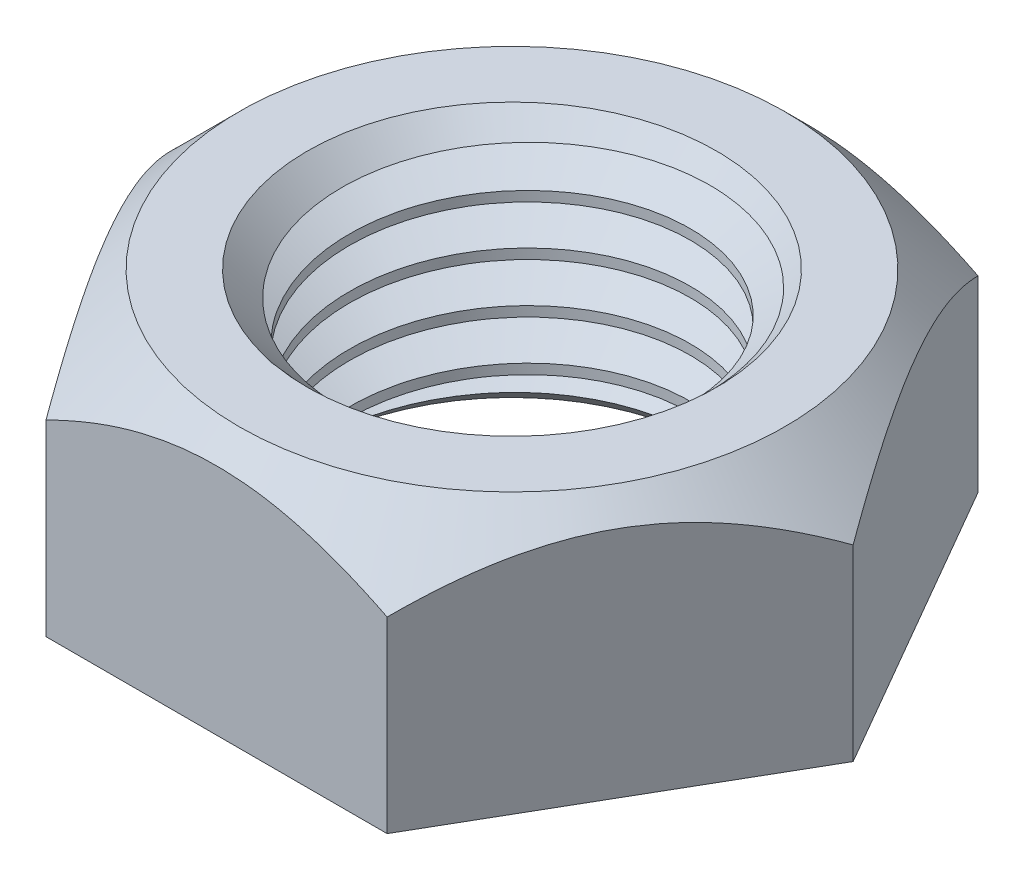
from build123d import *

# Parameters (mm, degrees)
SKETCH1_R           = 12.7
SKETCH1_R_2         = 6.35
BOSS_EXTRUDE1_DEPTH = 9.525
CHAMFER1_SIZE       = 2.54
SKETCH2_OUTSIDE_W   = 34.832
SKETCH2_OUTSIDE_H   = 34.832
CUT_EXTRUDE1_DEPTH  = 21.329919454
CHAMFER2_SIZE       = 1.27
CUT_SWEEP1_PITCH    = 1.856153846


with BuildPart() as part:
    # Sketch1 → Boss-Extrude1 (new body)
    with BuildSketch(Plane(origin=(0, 0, 0), x_dir=(1, 0, 0), z_dir=(0, 1, 0))):
        with Locations(Location((0, 0, 0), (0, 0, 90))):
            Circle(SKETCH1_R)
        with Locations(Location((0, 0, 0), (0, 0, 90))):
            Circle(SKETCH1_R_2, mode=Mode.SUBTRACT)
    extrude(amount=BOSS_EXTRUDE1_DEPTH)

    # Chamfer1
    chamfer1_edges = [part.edges().sort_by_distance(p)[0] for p in [
        (0, 9.525, 12.7),
    ]]
    chamfer(chamfer1_edges, length=CHAMFER1_SIZE)

    # Sketch2 outside → Cut-Extrude1 (cut, through all)
    with BuildSketch(Plane(origin=(0, 9.525, 0), x_dir=(1, 0, 0), z_dir=(0, 1, 0))):
        Rectangle(SKETCH2_OUTSIDE_W, SKETCH2_OUTSIDE_H)
        Polygon((-12.7, 0), (-6.35, -10.998522628), (6.35, -10.998522628), (12.7, 0), (6.35, 10.998522628), (-6.35, 10.998522628), align=None, mode=Mode.SUBTRACT)
    extrude(amount=-CUT_EXTRUDE1_DEPTH, mode=Mode.SUBTRACT)

    # Chamfer2
    chamfer2_edges = [part.edges().sort_by_distance(p)[0] for p in [
        (0, 0, 6.35),
        (0, 9.525, 6.35),
    ]]
    chamfer(chamfer2_edges, length=CHAMFER2_SIZE)

    # Cut-Sweep1: the profile of Sketch6 screwed along a left-hand helix of 6.5 turns, 10 arcs to a turn; built about Z, then put on its axis
    cut_sweep1_z = Axis((0, 0, 0), (0, 0, 1))
    cut_sweep1_corners = [(6.096, 0, 0.146646968), (6.096, 0, -1.631353032), (7.635793168, 0, -0.742353032)]
    with BuildLine(mode=Mode.PRIVATE) as cut_sweep1_profile:
        Line(cut_sweep1_corners[0], cut_sweep1_corners[1])
        Line(cut_sweep1_corners[1], cut_sweep1_corners[2])
        Line(cut_sweep1_corners[2], cut_sweep1_corners[0])
    cut_sweep1_cap = Face(cut_sweep1_profile.wire())
    cut_sweep1_turn_angles = [0, -18, -36, -54, -72, -90, -108, -126, -144, -162, -180, -198, -216, -234, -252, -270, -288, -306, -324, -342, -360]
    cut_sweep1_turn_weights = [1, 0.9510565162951535, 1, 0.9510565162951535, 1, 0.9510565162951535, 1, 0.9510565162951535, 1, 0.9510565162951535, 1, 0.9510565162951535, 1, 0.9510565162951535, 1, 0.9510565162951535, 1, 0.9510565162951535, 1, 0.9510565162951535, 1]
    cut_sweep1_turn_rails = [Edge.make_bspline([Vector(p[0], p[1], 0).rotate(cut_sweep1_z, cut_sweep1_turn_angles[k]) / cut_sweep1_turn_weights[k] + Vector(0, 0, p[2] + -CUT_SWEEP1_PITCH * cut_sweep1_turn_angles[k] / 360) for k in range(21)], [0, 0, 0, 1, 1, 2, 2, 3, 3, 4, 4, 5, 5, 6, 6, 7, 7, 8, 8, 9, 9, 10, 10, 10], 2, cut_sweep1_turn_weights) for p in cut_sweep1_corners]
    cut_sweep1_turn_sides = [Face.make_surface_from_curves(cut_sweep1_turn_rails[p[0]], cut_sweep1_turn_rails[p[1]]) for p in [(0, 1), (1, 2), (2, 0)]]
    cut_sweep1_last_angles = [-2160, -2178, -2196, -2214, -2232, -2250, -2268, -2286, -2304, -2322, -2340]
    cut_sweep1_last_weights = [1, 0.9510565162951535, 1, 0.9510565162951535, 1, 0.9510565162951535, 1, 0.9510565162951535, 1, 0.9510565162951156, 1]
    cut_sweep1_last_rails = [Edge.make_bspline([Vector(p[0], p[1], 0).rotate(cut_sweep1_z, cut_sweep1_last_angles[k]) / cut_sweep1_last_weights[k] + Vector(0, 0, p[2] + -CUT_SWEEP1_PITCH * cut_sweep1_last_angles[k] / 360) for k in range(11)], [0, 0, 0, 1, 1, 2, 2, 3, 3, 4, 4, 5, 5, 5], 2, cut_sweep1_last_weights) for p in cut_sweep1_corners]
    cut_sweep1_last_sides = [Face.make_surface_from_curves(cut_sweep1_last_rails[p[0]], cut_sweep1_last_rails[p[1]]) for p in [(0, 1), (1, 2), (2, 0)]]
    cut_sweep1 = Plane(origin=(0, 0, 0), x_dir=(0, 0, -1), z_dir=(0, 1, 0)) * Solid(Shell([*[p.moved(Location((0, 0, CUT_SWEEP1_PITCH * i))) for i in range(6) for p in cut_sweep1_turn_sides], *cut_sweep1_last_sides, cut_sweep1_cap, cut_sweep1_cap.rotate(cut_sweep1_z, -2340).moved(Location((0, 0, -CUT_SWEEP1_PITCH * -2340 / 360)))]))
    add(cut_sweep1, mode=Mode.SUBTRACT)


solid = part.part
